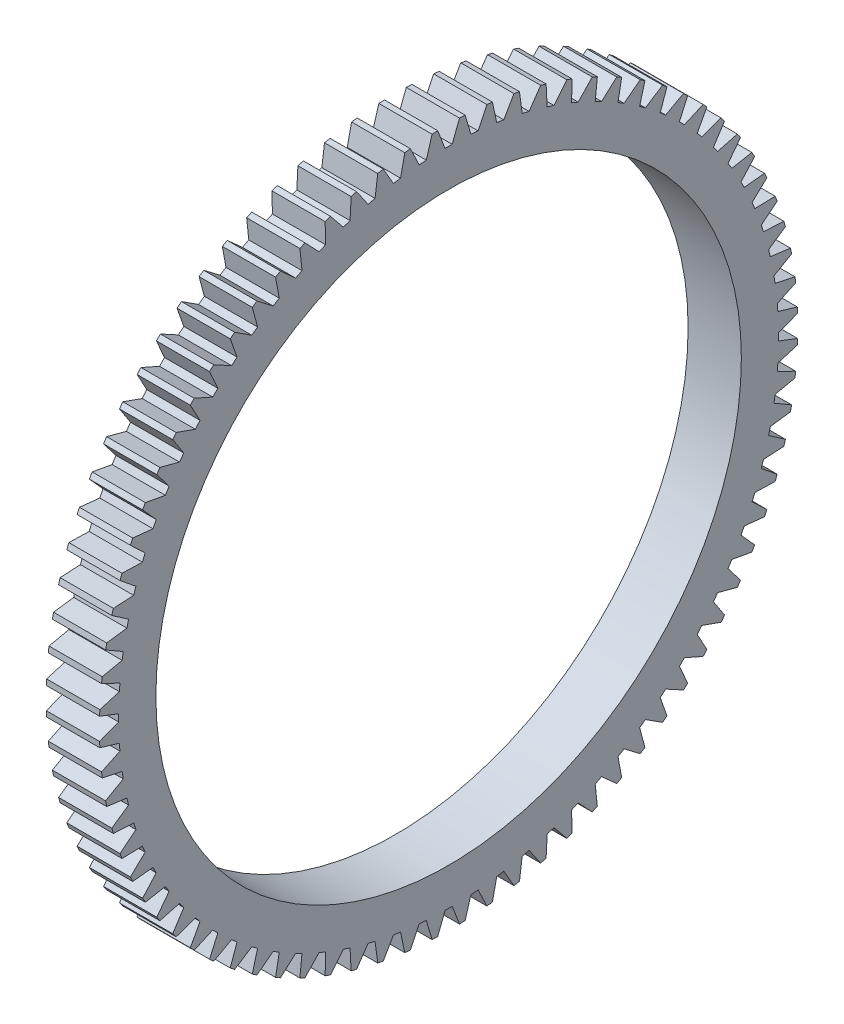
from build123d import *

# Parameters (mm, degrees)
SKETCH1_R               = 22.65
BOSS_EXTRUDE1_DEPTH     = 4.2
SKETCH2_R               = 20.049999999999997
CUT_EXTRUDE1_DEPTH      = 2.25
FILLET1_R               = 0.3
SKETCH3_R               = 2.625
CUT_EXTRUDE2_DEPTH      = 11.250000000000004
SKETCH6_R               = 5.275
CUT_EXTRUDE5_DEPTH      = 5
BOSS_EXTRUDE5_DEPTH     = 9.97
FILLET3_START           = -8.385
FILLET3_DEPTH           = 16.77
SKETCH9_R               = 2.045
CUT_EXTRUDE6_DEPTH      = 9.97
FILLET4_R               = 0.5
CUT_EXTRUDE7_DEPTH      = 19.970000000000006
CUT_EXTRUDE7_DEPTH_BACK = 19.970000000000006
BOSS_EXTRUDE6_START     = 20.3
BOSS_EXTRUDE6_DEPTH     = 20.3
SKETCH12_W              = 1.5
SKETCH12_H              = 25.4
BOSS_EXTRUDE7_DEPTH     = 8
CUT_EXTRUDE8_DEPTH      = 4
FILLET5_R               = 0.25
BOSS_EXTRUDE8_START     = 5
BOSS_EXTRUDE8_DEPTH     = 5
SKETCH22_R              = 54.91115118172833
CUT_EXTRUDE9_DEPTH      = 27.22
SKETCH23_R              = 27.50000000000001
CUT_EXTRUDE10_DEPTH     = 10


with BuildPart() as part:
    # Sketch1 → Boss-Extrude1 (new body)
    with BuildSketch(Plane(origin=(0, 0, 0), x_dir=(0, 0, -1), z_dir=(1, 0, 0))):
        Circle(SKETCH1_R)
    extrude(amount=BOSS_EXTRUDE1_DEPTH)

    # Sketch2 → Cut-Extrude1 (cut)
    with BuildSketch(Plane.ZY):
        Circle(SKETCH2_R)
    extrude(amount=-CUT_EXTRUDE1_DEPTH, mode=Mode.SUBTRACT)

    # Fillet1
    fillet1_edges = [part.edges().sort_by_distance(p)[0] for p in [
        (2.25, 2.46e-15, -20.049999999999997),
        (0, 2.46e-15, -20.049999999999997),
    ]]
    fillet(fillet1_edges, radius=FILLET1_R)

    # Sketch3 → Cut-Extrude2 (cut)
    with BuildSketch(Plane(origin=(4.2, 0, 0), x_dir=(0, 0, -1), z_dir=(1, 0, 0))):
        Circle(SKETCH3_R)
    extrude(amount=-CUT_EXTRUDE2_DEPTH, mode=Mode.SUBTRACT)

    # Sketch6 → Cut-Extrude5 (cut)
    with BuildSketch(Plane(origin=(4.2, 0, 0), x_dir=(0, 0, -1), z_dir=(1, 0, 0))):
        Circle(SKETCH6_R)
    extrude(amount=-CUT_EXTRUDE5_DEPTH, mode=Mode.SUBTRACT)

    # Sketch8 → Boss-Extrude5 (add)
    with BuildSketch(Plane(origin=(4.2, 0, 0), x_dir=(0, 0, -1), z_dir=(1, 0, 0))):
        Polygon((8.385, -18.970000000000002), (-8.385, -18.970000000000002), (-8.385, 7.339999999999999), (-6.235, 7.339999999999999), (-6.235, -13.37), (6.235, -13.37), (6.235, 7.339999999999999), (8.385, 7.339999999999999), align=None)
    extrude(amount=BOSS_EXTRUDE5_DEPTH)

    # Fillet3: read off the stored shape, not the designer's step
    # Fillet3 outline → Fillet3 (cut)
    with BuildSketch(Plane.XY.offset(FILLET3_START)):
        with BuildLine():
            Line((14.17, 7.34), (4.2, 7.34))
            add(Edge.make_bspline(
                [(4.2, 7.34), (14.169999999999998, 6.57505338615603), (14.17, -12.601391626)],
                knots=[0, 0, 0, 1, 1, 1], degree=2, weights=[1, 0.733655232380987, 1]))
            Line((14.17, -12.601391626), (14.17, 7.34))
        make_face()
    extrude(amount=FILLET3_DEPTH, mode=Mode.SUBTRACT)

    # Sketch9 → Cut-Extrude6 (cut)
    with BuildSketch(Plane.XZ.offset(18.970000000000002)):
        with Locations(Location((8.035000000000002, 0, 0), (0, 0, 270))):
            Circle(SKETCH9_R)
    extrude(amount=-CUT_EXTRUDE6_DEPTH, mode=Mode.SUBTRACT)

    # Fillet4
    fillet4_edges = [part.edges().sort_by_distance(p)[0] for p in [
        (4.2, 7.339999999999999, -7.3100000000000005),
        (4.2, -18.970000000000002, 0),
        (4.2, 7.339999999999999, 7.3100000000000005),
        (9.185, -13.37, 6.235),
        (12.196725877119425, -0.808020121977429, 6.235),
        (4.2, -3.0149999999999997, 6.235),
        (9.185, -13.37, -6.235),
        (4.2, -3.0150000000000006, -6.235),
        (12.196725877119441, -0.8080201219774263, -6.235),
        (9.185, -18.970000000000002, -8.385),
        (12.196714654052263, -0.807990395513789, -8.385),
        (4.2, -5.815000000000002, -8.385),
        (9.185, -18.970000000000002, 8.385),
        (4.2, -5.815000000000001, 8.385),
        (12.196714654052263, -0.807990395513789, 8.385),
        (14.170000000000002, -18.970000000000002, 0),
        (14.170000000000002, -15.785695813, 8.385),
        (14.170000000000002, -12.985695812999996, 6.235),
        (14.170000000000002, -13.37, 0),
        (14.170000000000002, -12.985695813, -6.235),
        (14.170000000000002, -15.785695813, -8.385),
        (4.2, -13.37, 0),
    ]]
    fillet(fillet4_edges, radius=FILLET4_R)

    # Sketch10 → Cut-Extrude7 (cut, two sides: drawn at the far end of the back side and taken through both)
    with BuildSketch(Plane.XY.offset(-CUT_EXTRUDE7_DEPTH_BACK)):
        Polygon((4.2, 22.65), (4.2, 19.650000000000002), (2.1, 22.65), align=None)
    extrude(amount=CUT_EXTRUDE7_DEPTH + CUT_EXTRUDE7_DEPTH_BACK, mode=Mode.SUBTRACT)

    # Sketch11 → Boss-Extrude6 (add)
    with BuildSketch(Plane.ZY.offset(-2.25).offset(BOSS_EXTRUDE6_START)):
        with BuildLine():
            Line((21.93021383723068, 5.664646595625885), (22.89843519869782, 5.9147413680597))
            ThreePointArc((22.89843519869782, 5.9147413680597), (22.668143265070608, 6.743721592283742), (22.40785088445694, 7.563776751064401))
            Line((22.40785088445694, 7.563776751064401), (21.460373045790686, 7.243955323958084))
            ThreePointArc((21.460373045790686, 7.243955323958084), (20.27997950144928, 10.086869257643675), (18.72501619917595, 12.743479444037188))
            Line((18.72501619917595, 12.743479444037188), (19.551727731148407, 13.306105468056478))
            ThreePointArc((19.551727731148407, 13.306105468056478), (18.925107528838943, 14.183187406992959), (18.259172678852046, 15.03080547022891))
            Line((18.259172678852046, 15.03080547022891), (17.48711463746295, 14.39525344188942))
            ThreePointArc((17.48711463746295, 14.39525344188942), (16.015968593875183, 16.01596859387542), (14.395253441889214, 17.48711463746323))
            Line((14.395253441889214, 17.48711463746323), (15.030805470228703, 18.259172678852327))
            ThreePointArc((15.030805470228703, 18.259172678852327), (14.183187406992523, 18.925107528839266), (13.306105468055858, 19.551727731148823))
            Line((13.306105468055858, 19.551727731148823), (12.743479444036604, 18.725016199176352))
            ThreePointArc((12.743479444036604, 18.725016199176352), (10.086869257643329, 20.27997950144968), (7.243955323957898, 21.460373045790963))
            Line((7.243955323957898, 21.460373045790963), (7.563776751064213, 22.40785088445721))
            ThreePointArc((7.563776751064213, 22.40785088445721), (6.7437215922832605, 22.668143265070754), (5.91474136805898, 22.898435198698003))
            Line((5.91474136805898, 22.898435198698003), (5.664646595625197, 21.93021383723086))
            ThreePointArc((5.664646595625197, 21.93021383723086), (4.935032060919599, 22.10583539605992), (4.199999999999458, 22.25718984957455))
            Line((4.199999999999458, 22.25718984957455), (3.2728476821187833, 17.34390290706362))
            ThreePointArc((3.2728476821187833, 17.34390290706362), (12.480434687942365, 12.48043468794276), (17.343902907063512, 3.2728476821193264))
            Line((17.343902907063512, 3.2728476821193264), (22.257189849574424, 4.200000000000156))
            ThreePointArc((22.257189849574424, 4.200000000000156), (22.10583539605977, 4.93503206092029), (21.93021383723068, 5.664646595625885))
        make_face()
    extrude(amount=-BOSS_EXTRUDE6_DEPTH)

    # Sketch12 → Boss-Extrude7 (add)
    with BuildSketch(Plane(origin=(4.2, 0, 0), x_dir=(0, 0, -1), z_dir=(1, 0, 0))):
        with Locations((13.435, -1.712172825517933)):
            Rectangle(SKETCH12_W, SKETCH12_H)
    boss_extrude7 = extrude(amount=BOSS_EXTRUDE7_DEPTH)

    # Sketch13 → Cut-Extrude8 (cut)
    with BuildSketch(Plane(origin=(0, 0, -14.185), x_dir=(-1, 0, 0), z_dir=(0, 0, -1))):
        Polygon((-6.700000000000001, 10.987827174482067), (-12.200000000000001, -14.412172825517931), (-12.200000000000001, 10.987827174482067), align=None)
    cut_extrude8 = extrude(amount=-CUT_EXTRUDE8_DEPTH, mode=Mode.SUBTRACT)

    # Mirror1: Boss-Extrude7, Cut-Extrude8 across plane
    add(boss_extrude7.mirror(Plane.XY))
    add(cut_extrude8.mirror(Plane.XY), mode=Mode.SUBTRACT)

    # Fillet5
    fillet5_edges = [part.edges().sort_by_distance(p)[0] for p in [
        (4.2, -14.412172825517931, -13.435),
        (8.2, -14.412172825517931, -12.685),
        (4.2, -1.712172825517932, -14.185),
        (8.2, -14.412172825517931, -14.185),
        (4.2, 10.987827174482067, -13.435),
        (4.2, -1.712172825517932, -12.685),
        (12.2, -14.412172825517931, -13.435),
        (5.450000000000001, 10.987827174482067, -12.685),
        (5.450000000000001, 10.987827174482067, -14.185),
        (9.450000000000001, -1.712172825517933, -12.685),
        (6.700000000000001, 10.987827174482067, -13.435),
        (9.450000000000001, -1.712172825517932, -14.185),
        (12.2, -14.412172825517931, 13.435),
        (8.2, -14.412172825517931, 14.185),
        (8.2, -14.412172825517931, 12.685),
        (4.2, -14.412172825517931, 13.435),
        (4.2, -1.712172825517932, 14.185),
        (4.2, 10.987827174482067, 13.435),
        (4.2, -1.712172825517932, 12.685),
        (5.450000000000001, 10.987827174482067, 14.185),
        (5.450000000000001, 10.987827174482067, 12.685),
        (6.700000000000001, 10.987827174482067, 13.435),
        (9.450000000000001, -1.7121728255179312, 12.685),
        (9.450000000000001, -1.7121728255179338, 14.185),
    ]]
    fillet(fillet5_edges, radius=FILLET5_R)

    # Sketch14 → Boss-Extrude8 (add)
    with BuildSketch(Plane.ZY.offset(18.050000000000004).offset(BOSS_EXTRUDE8_START)):
        Polygon((-29.376333173783852, 9.897931615385438), (-30.86325723914443, 11.104024162005341), (-30.680091743119068, 11.600515964119726), (-28.766131362916767, 11.55195599937157), (-28.509192978345446, 12.172260132097865), (-29.896904422476446, 13.49129741549374), (-29.675349266716754, 13.971887699891273), (-27.77109895853734, 13.773309828618778), (-27.46628412792687, 14.371542617408673), (-28.746227248314337, 15.79539233410398), (-28.487648394030135, 16.257118101868866), (-26.604848494251033, 15.909746622682261), (-26.25403650239329, 16.48221976346028), (-27.41832002407577, 18.00210340647351), (-27.12431169588992, 18.442117964708086), (-25.274570291987764, 17.948094538289297), (-24.879924011469427, 18.491278543775913), (-25.921369739372178, 20.097825525035294), (-25.593744596395634, 20.513416037668346), (-23.788465959226908, 19.8757864827207), (-23.352418515600565, 20.38633244289507), (-24.264605590495222, 22.069637866030053), (-23.90538355068085, 22.458242079353337), (-22.15569782335977, 21.680937594116436), (-21.680937594115868, 22.155697823360335), (-22.458242079352722, 23.905383550681435), (-22.069637866029428, 24.264605590495798), (-20.386332442894474, 23.352418515601098), (-19.875786482720088, 23.788465959227423), (-20.51341603766769, 25.59374459639617), (-20.097825525034622, 25.9213697393727), (-18.491278543775273, 24.87992401146991), (-17.948094538288647, 25.274570291988233), (-18.442117964707393, 27.12431169589041), (-18.00210340647281, 27.418320024076248), (-16.482219763459614, 26.254036502393728), (-15.90974662268158, 26.60484849425144), (-16.25711810186814, 28.487648394030554), (-15.795392334103244, 28.746227248314742), (-14.371542617407975, 27.466284127927235), (-13.773309828618071, 27.771098958537713), (-13.971887699890518, 29.675349266717127), (-13.491297415492976, 29.89690442247681), (-12.172260132097144, 28.509192978345773), (-11.55195599937084, 28.76613136291708), (-11.600515964118944, 30.680091743119387), (-11.104024162004555, 30.86325723914474), (-9.897931615384696, 29.376333173784126), (-9.259380519972312, 29.583811001734702), (-9.157623189865568, 31.49568125175955), (-8.648290907094648, 31.639327811858866), (-7.5625790588671435, 30.06235850658405), (-6.909717880611682, 30.219096608111194), (-6.658270623427949, 32.1170894121058), (-6.139238062893945, 32.22033140746873), (-5.180600687638944, 30.56303940244225), (-4.5174545328027245, 30.668071435029344), (-4.117867604497236, 32.54048503621043), (-3.5923347745316843, 32.60268594560412), (-2.7666821904469066, 30.87528899714247), (-2.097339575592966, 30.92796740338192), (-1.5520765624548638, 32.76325774925749), (-1.0232835477119004, 32.784034083391646), (-0.33570617753557874, 30.99718216809986), (0.3357061775365038, 30.997182168099854), (1.0232835477128759, 32.78403408339162), (1.5520765624558377, 32.76325774925745), (2.09733957559389, 30.92796740338187), (2.766682190447832, 30.875288997142402), (3.5923347745326546, 32.60268594560404), (4.117867604498206, 32.54048503621032), (4.517454532803644, 30.66807143502924), (5.180600687639862, 30.563039402442133), (6.1392380628949095, 32.22033140746859), (6.658270623428911, 32.117089412105635), (6.909717880612591, 30.21909660811103), (7.562579058868049, 30.06235850658387), (8.648290907095598, 31.639327811858653), (9.157623189866515, 31.49568125175932), (9.259380519973208, 29.583811001734478), (9.897931615385584, 29.37633317378389), (11.104024162005487, 30.86325723914447), (11.600515964119872, 30.680091743119107), (11.551955999371717, 28.766131362916802), (12.17226013209801, 28.50919297834548), (13.491297415493886, 29.89690442247648), (13.97188769989142, 29.67534926671679), (13.77330982861892, 27.77109895853738), (14.371542617408819, 27.466284127926894), (15.795392334104122, 28.746227248314366), (16.25711810186901, 28.487648394030163), (15.909746622682402, 26.604848494251062), (16.482219763460428, 26.254036502393333), (18.002103406473655, 27.41832002407581), (18.44211796470823, 27.12431169588996), (17.94809453828944, 25.2745702919878), (18.491278543776055, 24.879924011469466), (20.097825525035432, 25.92136973937222), (20.513416037668488, 25.593744596395673), (19.875786482720848, 23.78846595922695), (20.38633244289522, 23.352418515600608), (22.069637866030202, 24.264605590495265), (22.458242079353486, 23.90538355068089), (21.680937594116582, 22.155697823359812), (22.155697823360477, 21.68093759411591), (23.90538355068158, 22.458242079352765), (24.264605590495943, 22.06963786602947), (23.352418515601244, 20.386332442894513), (23.78846595922757, 19.875786482720127), (25.593744596396316, 20.513416037667728), (25.921369739372846, 20.09782552503466), (24.879924011470056, 18.491278543775312), (25.27457029198838, 17.94809453828869), (27.124311695890555, 18.442117964707432), (27.418320024076394, 18.002103406472852), (26.254036502393877, 16.482219763459653), (26.604848494251588, 15.90974662268162), (28.487648394030703, 16.257118101868176), (28.746227248314888, 15.795392334103285), (27.46628412792738, 14.371542617408014), (27.77109895853786, 13.77330982861811), (29.675349266717273, 13.971887699890557), (29.896904422476954, 13.491297415493015), (28.509192978345922, 12.172260132097186), (28.766131362917225, 11.551955999370884), (30.680091743119537, 11.600515964118989), (30.863257239144886, 11.104024162004597), (29.376333173784275, 9.897931615384739), (29.58381100173485, 9.259380519972359), (31.495681251759695, 9.157623189865612), (31.639327811859005, 8.648290907094692), (30.062358506584197, 7.5625790588671835), (30.21909660811134, 6.909717880611722), (32.11708941210594, 6.658270623427989), (32.220331407468876, 6.139238062893985), (30.563039402442396, 5.180600687638984), (30.66807143502949, 4.517454532802764), (32.54048503621057, 4.117867604497276), (32.602685945604264, 3.5923347745317242), (30.87528899714262, 2.766682190446948), (30.92796740338207, 2.0973395755930078), (32.76325774925764, 1.5520765624549053), (32.78403408339179, 1.0232835477119417), (30.997182168100004, 0.33570617753561754), (30.997182168099997, -0.335706177536464), (32.78403408339177, -1.0232835477128361), (32.763257749257605, -1.552076562455796), (30.92796740338202, -2.0973395755938498), (30.87528899714255, -2.7666821904477907), (32.602685945604186, -3.5923347745326133), (32.54048503621047, -4.117867604498164), (30.668071435029386, -4.517454532803601), (30.56303940244228, -5.180600687639819), (32.220331407468734, -6.139238062894867), (32.117089412105784, -6.658270623428868), (30.219096608111176, -6.90971788061255), (30.062358506584015, -7.562579058868006), (31.6393278118588, -8.648290907095557), (31.49568125175947, -9.157623189866475), (29.583811001734627, -9.259380519973167), (29.37633317378404, -9.897931615385543), (30.86325723914462, -11.104024162005446), (30.680091743119256, -11.600515964119829), (28.76613136291695, -11.551955999371675), (28.50919297834563, -12.17226013209797), (29.89690442247663, -13.491297415493843), (29.67534926671694, -13.971887699891377), (27.77109895853753, -13.77330982861888), (27.46628412792704, -14.371542617408778), (28.746227248314515, -15.79539233410408), (28.48764839403031, -16.25711810186897), (26.60484849425121, -15.909746622682363), (26.254036502393483, -16.48221976346039), (27.41832002407596, -18.002103406473616), (27.124311695890114, -18.44211796470819), (25.27457029198795, -17.948094538289396), (24.87992401146962, -18.49127854377601), (25.92136973937237, -20.09782552503539), (25.593744596395823, -20.513416037668446), (23.7884659592271, -19.875786482720805), (23.352418515600757, -20.386332442895174), (24.264605590495414, -22.06963786603016), (23.905383550681044, -22.458242079353443), (22.15569782335996, -21.680937594116543), (21.680937594116056, -22.155697823360434), (22.45824207935291, -23.905383550681538), (22.069637866029616, -24.264605590495897), (20.386332442894666, -23.352418515601205), (19.87578648272028, -23.788465959227537), (20.513416037667877, -25.593744596396277), (20.097825525034814, -25.92136973937281), (18.49127854377546, -24.879924011470017), (17.94809453828884, -25.27457029198834), (18.44211796470758, -27.124311695890515), (18.002103406473, -27.418320024076355), (16.482219763459803, -26.254036502393834), (15.909746622681766, -26.604848494251545), (16.257118101868326, -28.487648394030664), (15.795392334103434, -28.74622724831485), (14.371542617408165, -27.466284127927338), (13.773309828618261, -27.771098958537817), (13.971887699890708, -29.67534926671723), (13.491297415493166, -29.89690442247691), (12.172260132097346, -28.509192978345872), (11.551955999371044, -28.766131362917182), (11.600515964119149, -30.680091743119494), (11.104024162004759, -30.86325723914484), (9.897931615384886, -29.376333173784236), (9.259380519972506, -29.58381100173481), (9.15762318986576, -31.495681251759652), (8.64829090709484, -31.639327811858962), (7.562579058867316, -30.06235850658416), (6.909717880611858, -30.2190966081113), (6.6582706234281215, -32.117089412105905), (6.139238062894118, -32.22033140746884), (5.180600687639133, -30.563039402442353), (4.517454532802914, -30.668071435029447), (4.117867604497425, -32.54048503621053), (3.592334774531873, -32.60268594560423), (2.766682190447111, -30.875288997142576), (2.097339575593169, -30.927967403382027), (1.5520765624550679, -32.7632577492576), (1.0232835477121045, -32.784034083391745), (0.33570617753576737, -30.997182168099968), (-0.3357061775363152, -30.997182168099958), (-1.0232835477126874, -32.78403408339173), (-1.5520765624556472, -32.76325774925756), (-2.0973395755937156, -30.927967403381977), (-2.766682190447655, -30.87528899714251), (-3.59233477453248, -32.60268594560415), (-4.117867604498029, -32.540485036210434), (-4.517454532803453, -30.668071435029344), (-5.18060068763967, -30.563039402442236), (-6.139238062894718, -32.2203314074687), (-6.658270623428719, -32.11708941210574), (-6.909717880612388, -30.219096608111144), (-7.562579058867843, -30.062358506583983), (-8.648290907095394, -31.63932781185877), (-9.157623189866312, -31.495681251759436), (-9.259380519973018, -29.583811001734585), (-9.897931615385394, -29.376333173784), (-11.104024162005297, -30.86325723914458), (-11.60051596411968, -30.680091743119217), (-11.551955999371538, -28.766131362916905), (-12.172260132097833, -28.509192978345585), (-13.491297415493708, -29.896904422476588), (-13.971887699891242, -29.675349266716893), (-13.773309828618729, -27.77109895853749), (-14.371542617408627, -27.466284127927004), (-15.795392334103934, -28.746227248314476), (-16.257118101868823, -28.487648394030273), (-15.9097466226822, -26.604848494251176), (-16.482219763460225, -26.25403650239345), (-18.002103406473452, -27.41832002407593), (-18.442117964708025, -27.12431169589008), (-17.948094538289247, -25.27457029198791), (-18.491278543775863, -24.879924011469576), (-20.097825525035244, -25.921369739372327), (-20.5134160376683, -25.593744596395783), (-19.875786482720667, -23.78846595922705), (-20.38633244289504, -23.352418515600707), (-22.069637866030025, -24.264605590495368), (-22.458242079353308, -23.90538355068099), (-21.680937594116397, -22.155697823359922), (-22.15569782336029, -21.680937594116017), (-23.905383550681396, -22.45824207935287), (-24.264605590495755, -22.069637866029577), (-23.35241851560104, -20.38633244289463), (-23.788465959227374, -19.875786482720244), (-25.59374459639612, -20.51341603766785), (-25.921369739372647, -20.09782552503478), (-24.87992401146986, -18.491278543775422), (-25.274570291988184, -17.9480945382888), (-27.12431169589036, -18.442117964707545), (-27.4183200240762, -18.002103406472962), (-26.254036502393696, -16.482219763459753), (-26.604848494251403, -15.909746622681721), (-28.487648394030522, -16.25711810186828), (-28.746227248314707, -15.795392334103383), (-27.46628412792719, -14.371542617408128), (-27.771098958537667, -13.773309828618222), (-29.675349266717085, -13.971887699890669), (-29.89690442247676, -13.491297415493129), (-28.50919297834573, -12.172260132097309), (-28.766131362917037, -11.551955999371007), (-30.68009174311935, -11.600515964119111), (-30.863257239144698, -11.104024162004723), (-29.37633317378409, -9.897931615384849), (-29.583811001734663, -9.259380519972465), (-31.495681251759507, -9.157623189865724), (-31.639327811858816, -8.648290907094804), (-30.062358506584015, -7.562579058867283), (-30.21909660811116, -6.909717880611825), (-32.11708941210576, -6.658270623428089), (-32.2203314074687, -6.139238062894085), (-30.563039402442207, -5.180600687639095), (-30.668071435029304, -4.5174545328028755), (-32.540485036210384, -4.117867604497387), (-32.60268594560409, -3.592334774531835), (-30.87528899714243, -2.7666821904470726), (-30.92796740338188, -2.097339575593131), (-32.76325774925745, -1.55207656245503), (-32.7840340833916, -1.0232835477120665), (-30.99718216809982, -0.335706177535731), (-30.997182168099812, 0.33570617753635323), (-32.78403408339158, 1.0232835477127238), (-32.76325774925742, 1.5520765624556836), (-30.92796740338183, 2.0973395755937534), (-30.875288997142366, 2.7666821904476926), (-32.602685945603994, 3.592334774532518), (-32.54048503621028, 4.117867604498067), (-30.668071435029198, 4.517454532803491), (-30.56303940244148, 5.180600687639569), (-32.22033140746794, 6.139238062894617), (-32.11708941210498, 6.658270623428619), (-30.219096608110387, 6.909717880612304), (-30.06235850658372, 7.562579058868343), (-31.639327811858493, 8.648290907095916), (-31.49568125175915, 9.157623189866833), (-29.58381100173444, 9.259380519973062), align=None)
        with BuildLine():
            Line((17.343902907063516, 3.2728476821193273), (27.023078183810004, 5.09933774834456))
            ThreePointArc((27.023078183810004, 5.09933774834456), (-19.445436482629756, -19.44543648263037), (5.099337748343715, 27.02307818381017))
            Line((5.099337748343715, 27.02307818381017), (3.272847682118783, 17.343902907063615))
            ThreePointArc((3.272847682118783, 17.343902907063615), (12.480434687942369, 12.480434687942763), (17.343902907063516, 3.2728476821193273))
        make_face(mode=Mode.SUBTRACT)
    extrude(amount=-BOSS_EXTRUDE8_DEPTH)

    # Sketch22 → Cut-Extrude9 (cut)
    with BuildSketch(Plane(origin=(14.170000000000002, 0, 0), x_dir=(0, 0, -1), z_dir=(1, 0, 0))):
        with Locations((0, -16.256459158967118)):
            Circle(SKETCH22_R)
    extrude(amount=-CUT_EXTRUDE9_DEPTH, mode=Mode.SUBTRACT)

    # Sketch23 → Cut-Extrude10 (cut)
    with BuildSketch(Plane.ZY.offset(23.050000000000004)):
        Circle(SKETCH23_R)
    extrude(amount=-CUT_EXTRUDE10_DEPTH, mode=Mode.SUBTRACT)


solid = part.part
